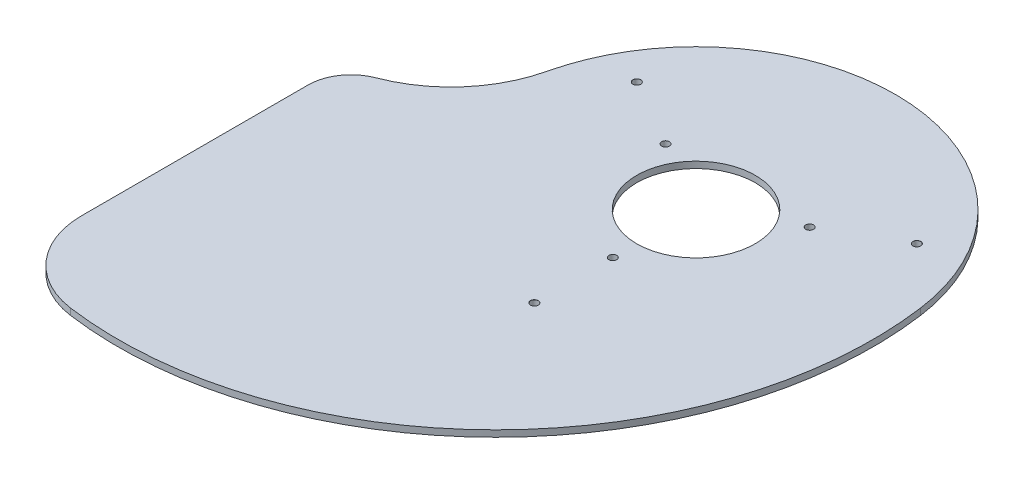
from build123d import *

# Parameters (mm, degrees)
SKETCH1_W                      = 400
SKETCH1_H                      = 400
BOSS_EXTRUDE1_DEPTH            = 3
HOLE1_D                        = 55
HOLE1_DEPTH                    = 100
M3_CLEARANCE_HOLE2_D           = 3.6
SKETCH14_W                     = 654.860874268
SKETCH14_H                     = 577.568605061
CUT_EXTRUDE2_DEPTH             = 324.704448038
M3_CLEARANCE_HOLE3_D           = 3.6
M3_CLEARANCE_HOLE3_CSINK_D     = 3.65
M3_CLEARANCE_HOLE3_CSINK_ANGLE = 90


with BuildPart() as part:
    # Sketch1 → Boss-Extrude1 (new body)
    with BuildSketch(Plane(origin=(0, 32, 0), x_dir=(1, 0, 0), z_dir=(0, 1, 0))):
        with Locations((0, -52.110233191)):
            Rectangle(SKETCH1_W, SKETCH1_H)
    extrude(amount=BOSS_EXTRUDE1_DEPTH)

    # Hole1
    with Locations(Plane(origin=(0, 35, 0), x_dir=(1, 0, 0), z_dir=(0, 1, 0))):
        with Locations((0, 0)):
            Hole(HOLE1_D / 2, depth=HOLE1_DEPTH)

    # M3 Clearance Hole2 (through all)
    with Locations(Plane(origin=(0, 32, 0), x_dir=(-1, 0, 0), z_dir=(0, -1, 0))):
        with Locations((-33.428580586, 19.3), (33.428580586, 19.3), (0, -38.6)):
            Hole(M3_CLEARANCE_HOLE2_D / 2)

    # Sketch14 → Cut-Extrude2 (cut, through all)
    with BuildSketch(Plane(origin=(0, 0, 0), x_dir=(1, 0, 0), z_dir=(0, 1, 0))):
        with Locations((9.012512487, -38.692079752)):
            Rectangle(SKETCH14_W, SKETCH14_H)
        with BuildLine():
            Line((-140, -145), (-140, -70))
            Line((-140, -70), (-140, -40))
            ThreePointArc((-140, -40), (-136.468645007, -28.651707986), (-127.121626837, -21.310900739))
            ThreePointArc((-127.121626837, -21.310900739), (-103.31209295, -4.731224861), (-90.065586424, 21.081749027))
            ThreePointArc((-90.065586424, 21.081749027), (4.310811973, 92.399496211), (91.63719038, 12.604576122))
            ThreePointArc((91.63719038, 12.604576122), (42.071647749, -134.927150214), (-105.413194935, -184.632023928))
            ThreePointArc((-105.413194935, -184.632023928), (-130.137416921, -171.300876436), (-140, -145))
        make_face(mode=Mode.SUBTRACT)
    extrude(amount=CUT_EXTRUDE2_DEPTH, mode=Mode.SUBTRACT)

    # M3 Clearance Hole3 (through all)
    with Locations(Plane(origin=(0, 35, 0), x_dir=(1, 0, 0), z_dir=(0, 1, 0))):
        with Locations((-64.951905284, 37.5), (0, -75), (64.951905284, 37.5)):
            CounterSinkHole(M3_CLEARANCE_HOLE3_D / 2, M3_CLEARANCE_HOLE3_CSINK_D / 2, counter_sink_angle=M3_CLEARANCE_HOLE3_CSINK_ANGLE)


solid = part.part
